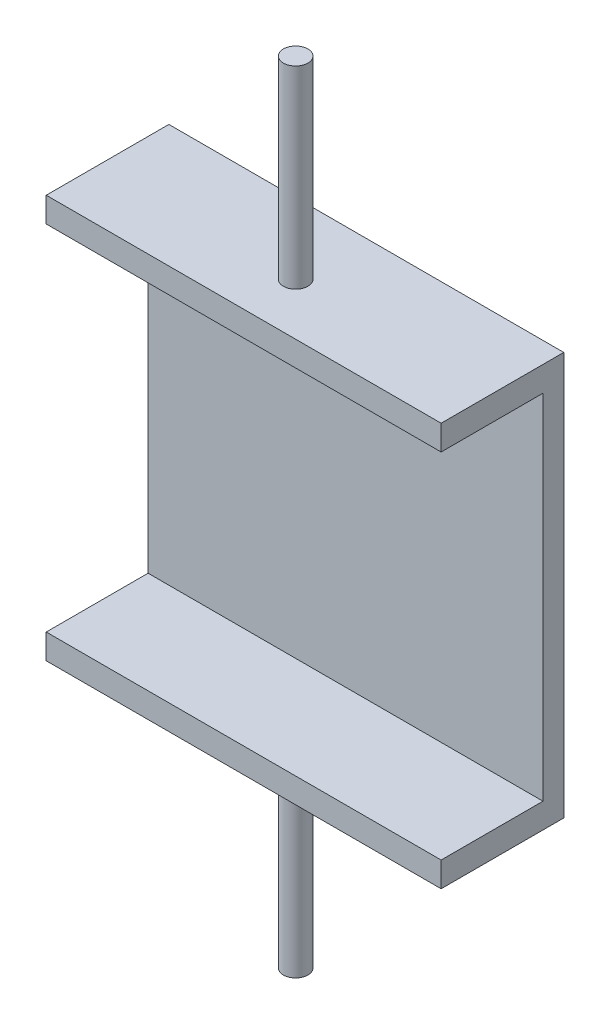
from build123d import *

# Parameters (mm, degrees)
SKETCH1_W           = 190
SKETCH1_H           = 170
BOSS_EXTRUDE1_DEPTH = 10
SKETCH2_W           = 190
SKETCH2_H           = 59
BOSS_EXTRUDE2_DEPTH = 12
SKETCH3_W           = 190
SKETCH3_H           = 59
BOSS_EXTRUDE3_DEPTH = 12
SKETCH4_R           = 5.9
BOSS_EXTRUDE4_DEPTH = 105
SKETCH5_R           = 5.9
BOSS_EXTRUDE5_DEPTH = 105


with BuildPart() as part:
    # Sketch1 → Boss-Extrude1 (new body)
    with BuildSketch(Plane.XY.offset(123)):
        with Locations((300, 300)):
            Rectangle(SKETCH1_W, SKETCH1_H)
    extrude(amount=BOSS_EXTRUDE1_DEPTH)

    # Sketch2 → Boss-Extrude2 (add)
    with BuildSketch(Plane(origin=(0, 385, 0), x_dir=(1, 0, 0), z_dir=(0, 1, 0))):
        with Locations((300, -152.5)):
            Rectangle(SKETCH2_W, SKETCH2_H)
    extrude(amount=BOSS_EXTRUDE2_DEPTH)

    # Sketch3 → Boss-Extrude3 (add)
    with BuildSketch(Plane(origin=(0, 203, 0), x_dir=(1, 0, 0), z_dir=(0, 1, 0))):
        with Locations((300, -152.5)):
            Rectangle(SKETCH3_W, SKETCH3_H)
    extrude(amount=BOSS_EXTRUDE3_DEPTH)

    # Sketch4 → Boss-Extrude4 (add)
    with BuildSketch(Plane(origin=(0, 385, 0), x_dir=(1, 0, 0), z_dir=(0, 1, 0))):
        with Locations((300, -157)):
            Circle(SKETCH4_R)
    extrude(amount=BOSS_EXTRUDE4_DEPTH)

    # Sketch5 → Boss-Extrude5 (add)
    with BuildSketch(Plane(origin=(0, 110, 0), x_dir=(1, 0, 0), z_dir=(0, 1, 0))):
        with Locations((300, -157)):
            Circle(SKETCH5_R)
    extrude(amount=BOSS_EXTRUDE5_DEPTH)


solid = part.part
